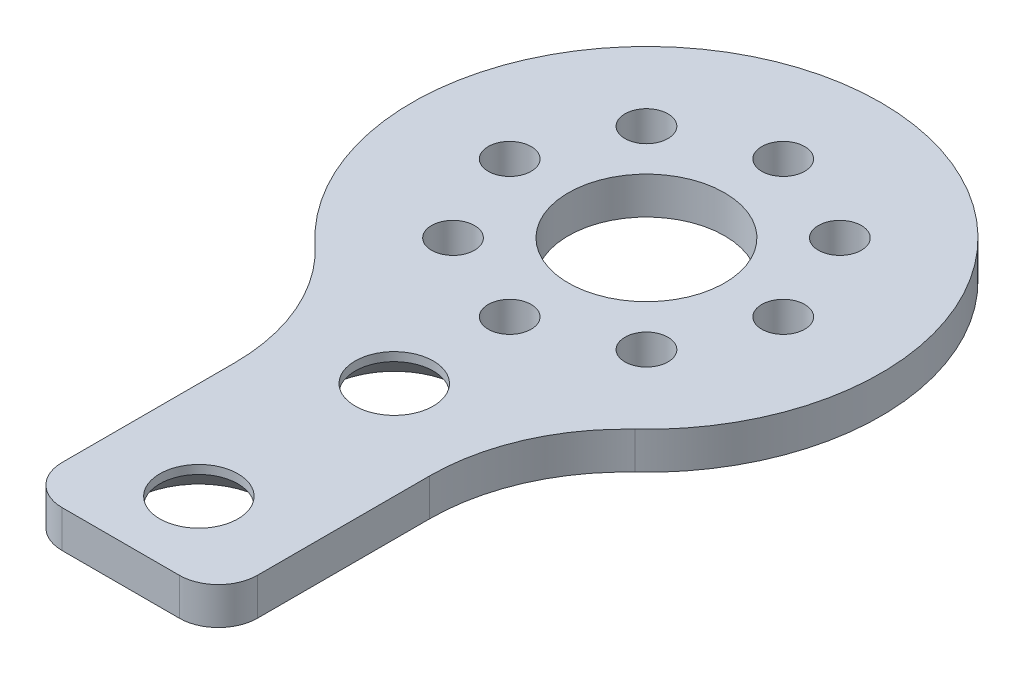
from build123d import *

# Parameters (mm, degrees)
BOSS_EXTRUDE1_DEPTH                            = 4.7625
M5_CLEARANCE_HOLE1_D                           = 5.5
M5_CLEARANCE_HOLE1_CSINK_D                     = 5.55
M5_CLEARANCE_HOLE1_CSINK_ANGLE                 = 90
SKETCH5_R                                      = 10
CUT_EXTRUDE1_DEPTH                             = 74.811745875
CSK_FOR_M8_FLAT_HEAD_MACHINE_SCREW1_AT_2_COUNT = 2
CSK_FOR_M8_FLAT_HEAD_MACHINE_SCREW1_AT_2_PITCH = 25
FILLET1_R                                      = 25
FILLET2_R                                      = 5


with BuildPart() as part:
    # Sketch1 → Boss-Extrude1 (new body)
    with BuildSketch(Plane(origin=(0, 0, 0), x_dir=(1, 0, 0), z_dir=(0, 1, 0))):
        with BuildLine():
            Line((-12.5, -67.271780287), (12.5, -67.271780287))
            Line((12.5, -67.271780287), (12.5, -27.271780287))
            ThreePointArc((12.5, -27.271780287), (0, 30), (-12.5, -27.271780287))
            Line((-12.5, -27.271780287), (-12.5, -67.271780287))
        make_face()
    extrude(amount=BOSS_EXTRUDE1_DEPTH)

    # M5 Clearance Hole1 (through all)
    with Locations(Plane(origin=(0, 0, 0), x_dir=(-1, 0, 0), z_dir=(0, -1, 0))):
        with Locations((0, 17.5), (12.374368671, 12.374368671), (17.5, 0), (12.374368671, -12.374368671), (0, -17.5), (-12.374368671, -12.374368671), (-17.5, 0), (-12.374368671, 12.374368671)):
            CounterSinkHole(M5_CLEARANCE_HOLE1_D / 2, M5_CLEARANCE_HOLE1_CSINK_D / 2, counter_sink_angle=M5_CLEARANCE_HOLE1_CSINK_ANGLE)

    # Sketch5 → Cut-Extrude1 (cut, through all)
    with BuildSketch(Plane.XZ):
        Circle(SKETCH5_R)
    extrude(amount=-CUT_EXTRUDE1_DEPTH, mode=Mode.SUBTRACT)

    # Sketch8 → CSK for M8 Flat Head Machine Screw1 (revolve, cut)
    with BuildSketch(Plane(origin=(0, 0, 32.271780287), x_dir=(0, 0, -1), z_dir=(1, 0, 0))):
        Polygon((0, 0), (0, 4.7625), (5, 4.7625), (5, 3.65), (8.65, 0), align=None)
    csk_for_m8_flat_head_machine_screw1 = revolve(axis=Axis((0, -6.35, 32.271780287), (0, 1, 0)), mode=Mode.SUBTRACT)

    # CSK for M8 Flat Head Machine Screw1 at 2: CSK for M8 Flat Head Machine Screw1 ×2
    with Locations(*[(0, 0, i * CSK_FOR_M8_FLAT_HEAD_MACHINE_SCREW1_AT_2_PITCH) for i in range(1, CSK_FOR_M8_FLAT_HEAD_MACHINE_SCREW1_AT_2_COUNT)]):
        add(csk_for_m8_flat_head_machine_screw1, mode=Mode.SUBTRACT)

    # Fillet1
    fillet1_edges = [part.edges().sort_by_distance(p)[0] for p in [
        (-12.5, 2.38125, 27.271780287),
        (12.5, 2.38125, 27.271780287),
    ]]
    fillet(fillet1_edges, radius=FILLET1_R)

    # Fillet2
    fillet2_edges = [part.edges().sort_by_distance(p)[0] for p in [
        (12.5, 2.38125, 67.271780287),
        (-12.5, 2.38125, 67.271780287),
    ]]
    fillet(fillet2_edges, radius=FILLET2_R)


solid = part.part
